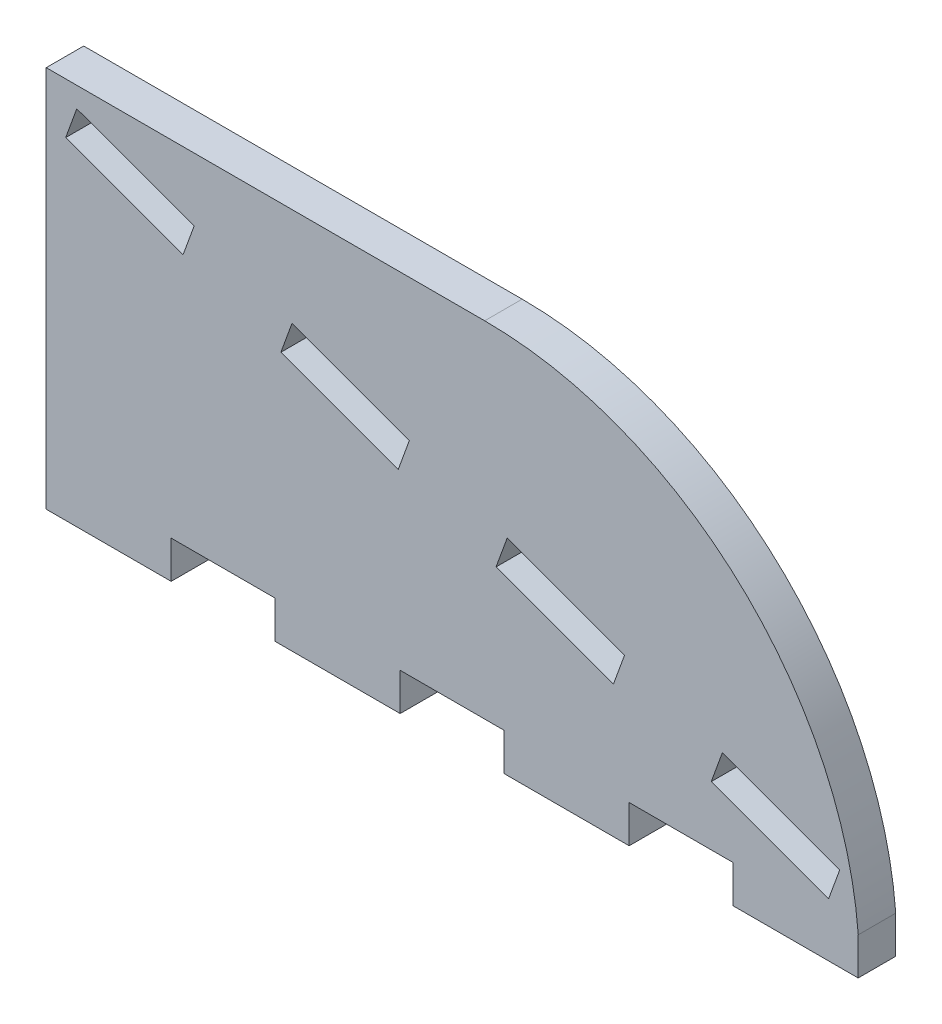
from build123d import *

# Parameters (mm, degrees)
BOSS_EXTRUDE1_DEPTH = 3
FILLET1_R           = 30


with BuildPart() as part:
    # Sketch1 → Boss-Extrude1 (new body)
    with BuildSketch(Plane.XY):
        Polygon((0, 0), (-0.01, 0), (-0.01, -3), (-10.01, -3), (-10.01, 0), (-18.34, 0), (-18.34, -3), (-28.34, -3), (-28.34, 0), (-36.67, 0), (-36.67, -3), (-46.67, -3), (-46.67, 0), (-55, 0), (-55, -3), (-65, -3), (-65, 0), (-65, 27.612062293), (0, 27.612062293), align=None)
        Polygon((-63.444972674, 23.538741566), (-62.555720301, 25.98194238), (-53.158794094, 22.561740947), (-54.048046466, 20.118540133), align=None, mode=Mode.SUBTRACT)
        Polygon((-45.331154562, 19.712713153), (-35.934228355, 16.29251172), (-36.823480727, 13.849310906), (-46.220406935, 17.269512339), align=None, mode=Mode.SUBTRACT)
        Polygon((-28.106588823, 13.443483926), (-18.709662616, 10.023282493), (-19.598914988, 7.580081679), (-28.995841196, 11.000283112), align=None, mode=Mode.SUBTRACT)
        Polygon((-10.882023084, 7.174254699), (-1.485096877, 3.754053266), (-2.374349249, 1.310852452), (-11.771275457, 4.731053885), align=None, mode=Mode.SUBTRACT)
    extrude(amount=BOSS_EXTRUDE1_DEPTH)

    # Fillet1
    # the kernel refuses this fillet: 30 mm, written as the material it takes off along each edge
    with BuildSketch(Plane(origin=(0, 27.612062293, -74.762028861), x_dir=(-1, 0, 0), z_dir=(0, 0, 1))) as fillet1_piece_1:
        with BuildLine():
            CenterArc((29.904811544, 30), FILLET1_R, 184.565454752, 85.434545248)
            Line((0, 27.612062293), (-0.598096231, 27.564303539))
            ThreePointArc((-0.598096231, 27.564303539), (-0.6, 13.806031146), (-0.6, 0))
            Line((-0.6, 0), (0, -0.6))
            Line((0, -0.6), (29.904811544, -0.6))
            Line((29.904811544, -0.6), (29.904811544, 0))
        make_face()
    extrude(amount=152.524057722, mode=Mode.SUBTRACT)


solid = part.part
